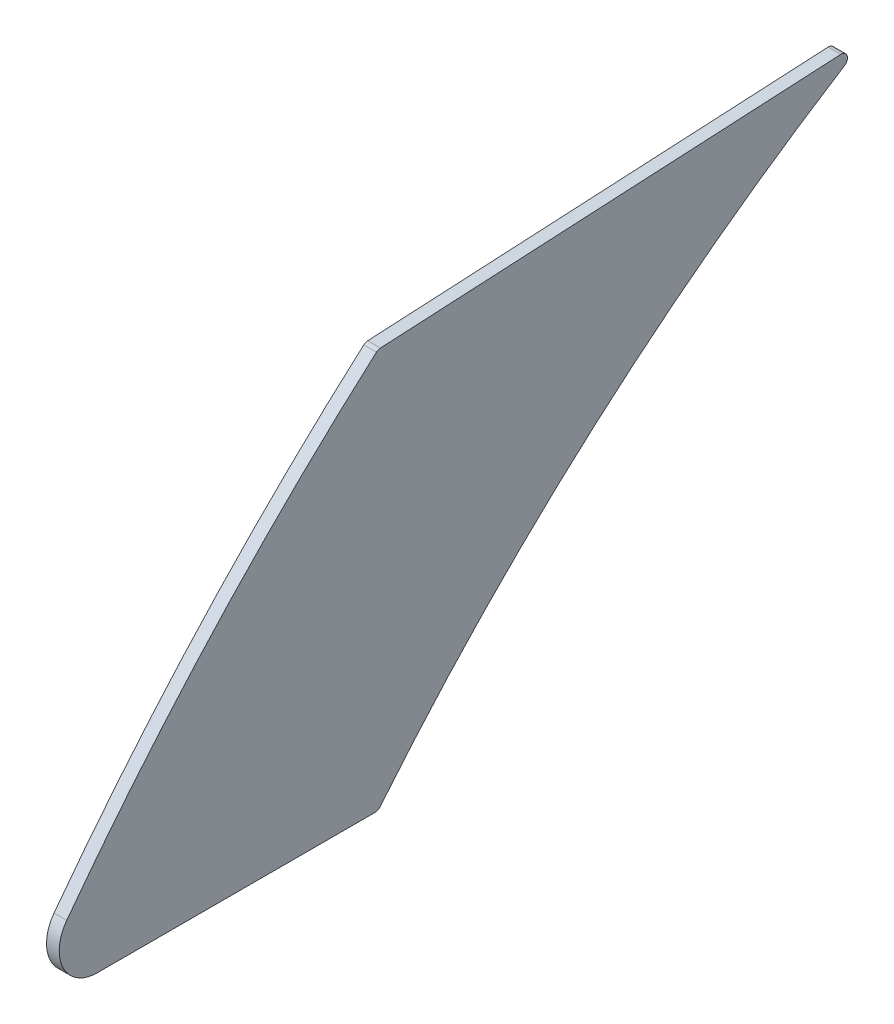
from build123d import *

# Parameters (mm, degrees)
BOSS_EXTRUDE1_DEPTH = 2


with BuildPart() as part:
    # Sketch1 → Boss-Extrude1 (new body)
    with BuildSketch(Plane(origin=(0, 0, 0), x_dir=(0, 0, -1), z_dir=(1, 0, 0))):
        with BuildLine():
            Line((0.348531139, 0.018265743), (72.985797314, 3.825023556))
            ThreePointArc((72.985797314, 3.825023556), (73.991753866, 3.127405248), (73.568595626, 1.978685529))
            ThreePointArc((73.568595626, 1.978685529), (34.286561941, -27.324507504), (0.299617848, -62.632338413))
            ThreePointArc((0.299617848, -62.632338413), (-0.046319499, -62.903420836), (-0.475074433, -63))
            Line((-0.475074433, -63), (-44.305483114, -63))
            ThreePointArc((-44.305483114, -63), (-49.666853492, -59.693642083), (-49.119354071, -53.418569223))
            ThreePointArc((-49.119354071, -53.418569223), (-26.066145165, -25.561463063), (-0.261851868, -0.231495595))
            ThreePointArc((-0.261851868, -0.231495595), (0.022157357, -0.054848295), (0.348531139, 0.018265743))
        make_face()
    extrude(amount=BOSS_EXTRUDE1_DEPTH)


solid = part.part
